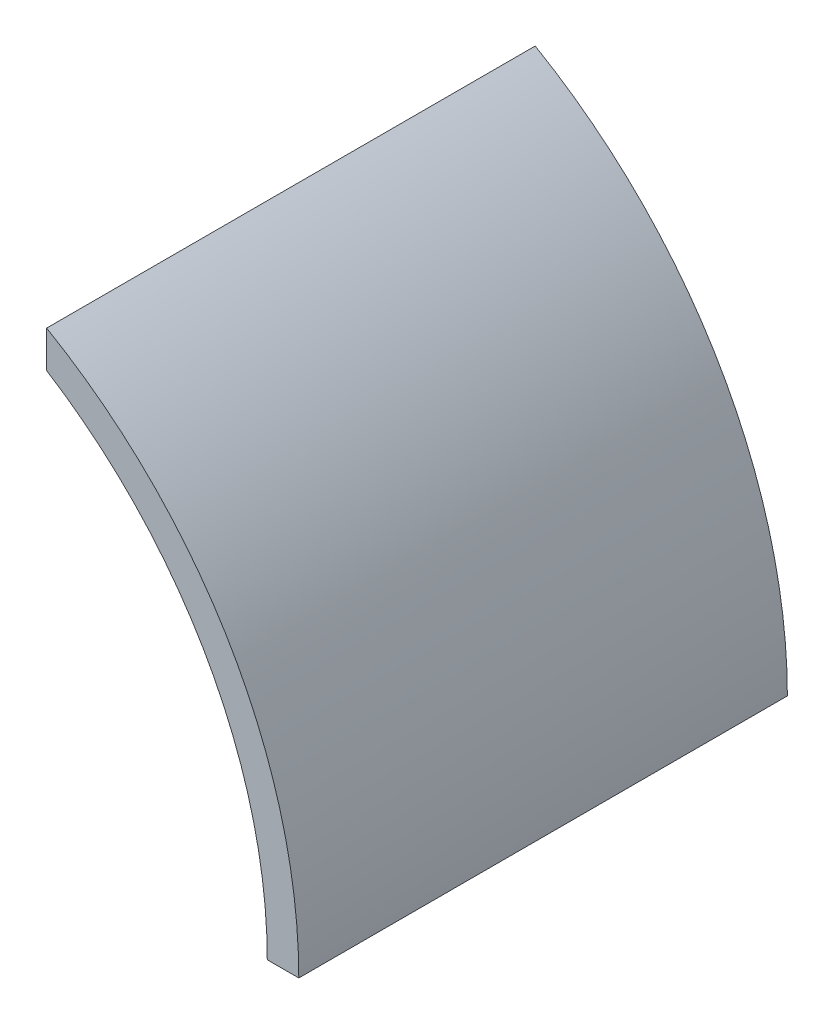
from build123d import *

# Parameters (mm, degrees)
INNER_RING_RIGHT_SIDE_DEPTH = 155


with BuildPart() as part:
    # Sketch2 → Inner Ring - Right Side (new body)
    with BuildSketch(Plane.XY):
        with BuildLine():
            Line((80, 138.564064606), (80, 126.885775404))
            ThreePointArc((80, 126.885775404), (131.339255366, 72.456883731), (150, 0))
            Line((150, 0), (160, 0))
            ThreePointArc((160, 0), (138.564064606, 80), (80, 138.564064606))
        make_face()
    extrude(amount=INNER_RING_RIGHT_SIDE_DEPTH)


solid = part.part
